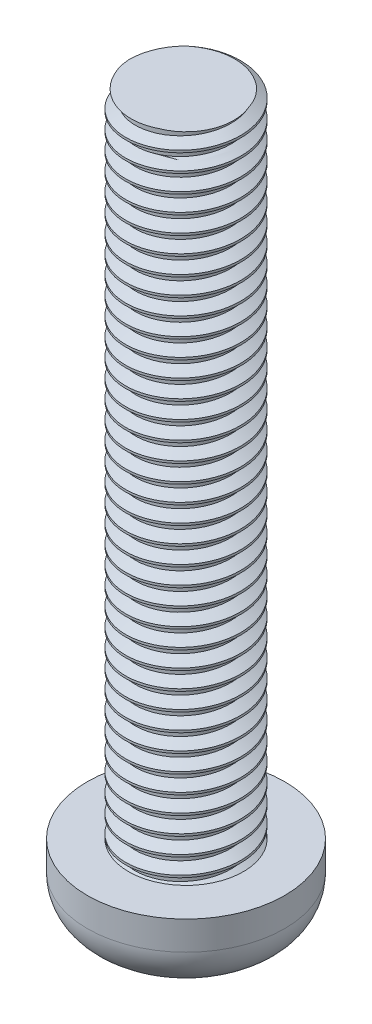
from build123d import *

# Parameters (mm, degrees)
SZKIC1_R                                   = 2.75
DODANIE_WYCI_GNI_CIE1_DEPTH                = 2
SZKIC2_R                                   = 1.6
DODANIE_WYCI_GNI_CIE2_DEPTH                = 18
GWINT1_PITCH                               = 0.5
ZAOKR_GLENIE1_R                            = 1.2
SZKIC6_W                                   = 0.4
SZKIC6_H                                   = 2
SZKIC6_W_2                                 = 2
SZKIC6_H_2                                 = 0.4
WYCI_CIE_WYCI_GNI_CIE_CIENKA_CIANKA1_DEPTH = 1


with BuildPart() as part:
    # Szkic1 → Dodanie-wyciągnięcie1 (new body)
    with BuildSketch(Plane(origin=(0, 0, 0), x_dir=(1, 0, 0), z_dir=(0, 1, 0))):
        with Locations(Location((0, 0, 0), (0, 0, 270))):
            Circle(SZKIC1_R)
    extrude(amount=DODANIE_WYCI_GNI_CIE1_DEPTH)

    # Szkic2 → Dodanie-wyciągnięcie2 (add)
    with BuildSketch(Plane(origin=(0, 2, 0), x_dir=(1, 0, 0), z_dir=(0, 1, 0))):
        with Locations(Location((0, 0, 0), (0, 0, 270))):
            Circle(SZKIC2_R)
    extrude(amount=DODANIE_WYCI_GNI_CIE2_DEPTH)

    # Gwint1: the profile of Profil gwintu1 profile screwed along a right-hand helix of 38 turns, 6 arcs to a turn; built about Z, then put on its axis
    gwint1_z = Axis((0, 0, 0), (0, 0, 1))
    gwint1_corners = [(1.6003, 0, -0.000173205), (1.6003, 0, 0.437673204), (1.329367063, 0, 0.281249999), (1.329367063, 0, 0.156249999)]
    with BuildLine(mode=Mode.PRIVATE) as gwint1_profile:
        Line(gwint1_corners[0], gwint1_corners[1])
        Line(gwint1_corners[1], gwint1_corners[2])
        Line(gwint1_corners[2], gwint1_corners[3])
        Line(gwint1_corners[3], gwint1_corners[0])
    gwint1_cap = Face(gwint1_profile.wire())
    gwint1_turn_angles = [0, 30, 60, 90, 120, 150, 180, 210, 240, 270, 300, 330, 360, 390, 420, 450, 480, 510, 540, 570, 600, 630, 660, 690, 720]
    gwint1_turn_weights = [1, 0.8660254037844387, 1, 0.8660254037844387, 1, 0.8660254037844387, 1, 0.8660254037844387, 1, 0.8660254037844387, 1, 0.8660254037844387, 1, 0.8660254037844387, 1, 0.8660254037844387, 1, 0.8660254037844387, 1, 0.8660254037844387, 1, 0.8660254037844387, 1, 0.8660254037844387, 1]
    gwint1_turn_rails = [Edge.make_bspline([Vector(p[0], p[1], 0).rotate(gwint1_z, gwint1_turn_angles[k]) / gwint1_turn_weights[k] + Vector(0, 0, p[2] + GWINT1_PITCH * gwint1_turn_angles[k] / 360) for k in range(25)], [0, 0, 0, 1, 1, 2, 2, 3, 3, 4, 4, 5, 5, 6, 6, 7, 7, 8, 8, 9, 9, 10, 10, 11, 11, 12, 12, 12], 2, gwint1_turn_weights) for p in gwint1_corners]
    gwint1_turn_sides = [Face.make_surface_from_curves(gwint1_turn_rails[p[0]], gwint1_turn_rails[p[1]]) for p in [(0, 1), (1, 2), (2, 3), (3, 0)]]
    gwint1 = Plane(origin=(0, 21, 0), x_dir=(-1, 0, 0), z_dir=(0, -1, 0)) * Solid(Shell([*[p.moved(Location((0, 0, 2 * GWINT1_PITCH * i))) for i in range(19) for p in gwint1_turn_sides], gwint1_cap, gwint1_cap.rotate(gwint1_z, 13680).moved(Location((0, 0, GWINT1_PITCH * 13680 / 360)))]))
    add(gwint1, mode=Mode.SUBTRACT)

    # Zaokrąglenie1
    zaokr_glenie1_edges = [part.edges().sort_by_distance(p)[0] for p in [
        (0, 0, -2.75),
    ]]
    fillet(zaokr_glenie1_edges, radius=ZAOKR_GLENIE1_R)

    # Szkic6 → Wycięcie-wyciągnięcie-cienka ścianka1 (cut)
    with BuildSketch(Plane.XZ):
        Rectangle(SZKIC6_W, SZKIC6_H)
        Rectangle(SZKIC6_W_2, SZKIC6_H_2)
    extrude(amount=-WYCI_CIE_WYCI_GNI_CIE_CIENKA_CIANKA1_DEPTH, mode=Mode.SUBTRACT)


solid = part.part
